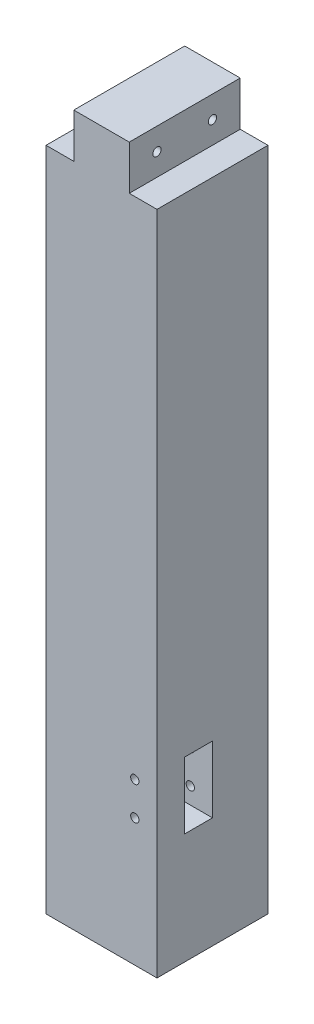
from build123d import *

# Parameters (mm, degrees)
BOSS_EXTRUDE1_DEPTH = 127
SKETCH2_W           = 31.75
SKETCH2_H           = 76.2
CUT_EXTRUDE1_DEPTH  = 50.8
SKETCH3_R           = 4.7625
CUT_EXTRUDE3_DEPTH  = 82.55
SKETCH4_W           = 31.75
SKETCH4_H           = 76.2
CUT_EXTRUDE4_DEPTH  = 63.5
SKETCH5_R           = 4.7625
CUT_EXTRUDE5_DEPTH  = 76.2
SKETCH6_R           = 4.7625
CUT_EXTRUDE6_DEPTH  = 461.057390442


with BuildPart() as part:
    # Sketch1 → Boss-Extrude1 (new body)
    with BuildSketch(Plane.XY):
        Polygon((63.5, -381), (63.5, 381), (31.75, 381), (31.75, 431.8), (-31.75, 431.8), (-31.75, 381), (-63.5, 381), (-63.5, -381), align=None)
    extrude(amount=BOSS_EXTRUDE1_DEPTH)

    # Sketch2 → Cut-Extrude1 (cut)
    with BuildSketch(Plane(origin=(63.5, 0, 0), x_dir=(0, 0, -1), z_dir=(1, 0, 0))):
        with Locations((-79.375, -215.9)):
            Rectangle(SKETCH2_W, SKETCH2_H)
    extrude(amount=-CUT_EXTRUDE1_DEPTH, mode=Mode.SUBTRACT)

    # Sketch3 → Cut-Extrude3 (cut)
    with BuildSketch(Plane.XY.offset(127)):
        with Locations((38.1, -196.85)):
            Circle(SKETCH3_R)
        with Locations((38.1, -234.95)):
            Circle(SKETCH3_R)
    extrude(amount=-CUT_EXTRUDE3_DEPTH, mode=Mode.SUBTRACT)

    # Sketch4 → Cut-Extrude4 (cut)
    with BuildSketch(Plane(origin=(0, 0, 0), x_dir=(-1, 0, 0), z_dir=(0, 0, -1))):
        with Locations((15.875, -215.9)):
            Rectangle(SKETCH4_W, SKETCH4_H)
    extrude(amount=-CUT_EXTRUDE4_DEPTH, mode=Mode.SUBTRACT)

    # Sketch5 → Cut-Extrude5 (cut)
    with BuildSketch(Plane.ZY.offset(63.5)):
        with Locations((31.75, -234.95)):
            Circle(SKETCH5_R)
        with Locations((31.75, -196.85)):
            Circle(SKETCH5_R)
    extrude(amount=-CUT_EXTRUDE5_DEPTH, mode=Mode.SUBTRACT)

    # Sketch6 → Cut-Extrude6 (cut, through all)
    with BuildSketch(Plane(origin=(31.75, 0, 0), x_dir=(0, 0, -1), z_dir=(1, 0, 0))):
        with Locations((-95.25, 406.4)):
            Circle(SKETCH6_R)
        with Locations((-31.75, 406.4)):
            Circle(SKETCH6_R)
    extrude(amount=-CUT_EXTRUDE6_DEPTH, mode=Mode.SUBTRACT)


solid = part.part
